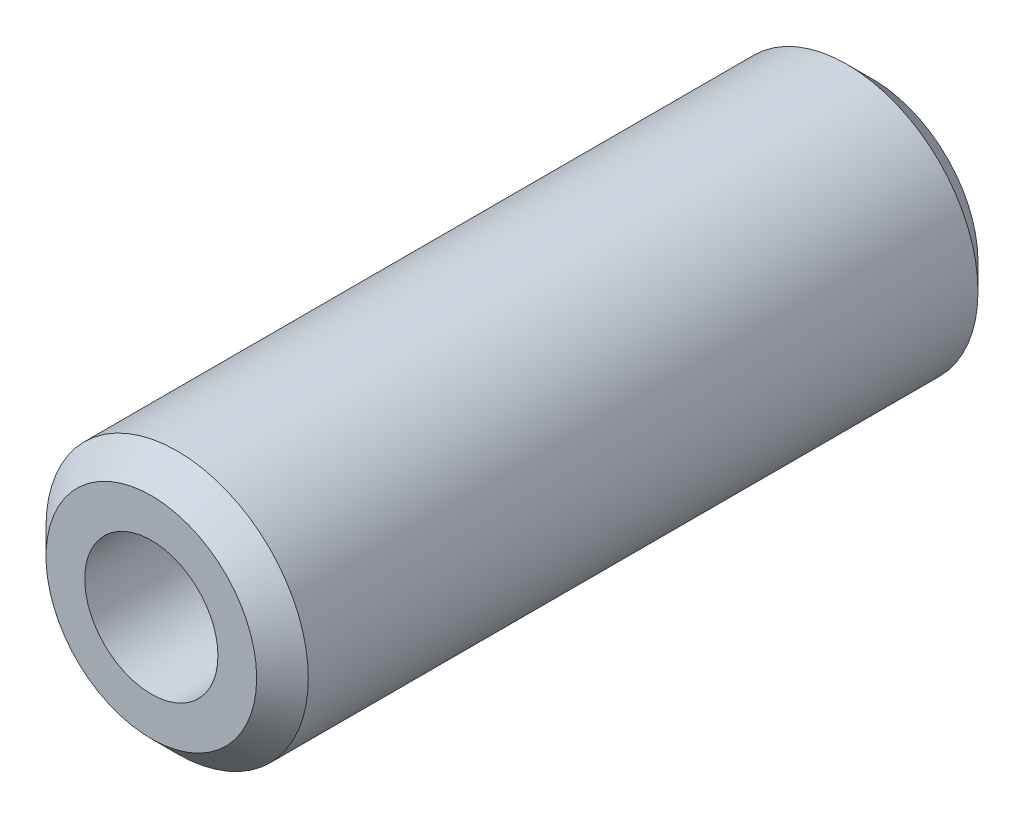
from build123d import *

# Parameters (mm, degrees)
SKETCH1_R               = 12.7
BOSS_EXTRUDE1_DEPTH     = 69.85
CUT_EXTRUDE1_DEPTH      = 73.122135992
CUT_EXTRUDE1_DEPTH_BACK = 73.122135992
SKETCH2_R               = 6.45
CHAMFER1_SIZE           = 2.5


with BuildPart() as part:
    # Sketch1 → Boss-Extrude1 (new body)
    with BuildSketch(Plane.XY):
        Circle(SKETCH1_R)
    extrude(amount=BOSS_EXTRUDE1_DEPTH)

    # Sketch2 → Cut-Extrude1 (cut, two sides: drawn at the far end of the back side and taken through both)
    with BuildSketch(Plane.XY.offset(69.85).offset(-CUT_EXTRUDE1_DEPTH_BACK)):
        Circle(SKETCH2_R)
    extrude(amount=CUT_EXTRUDE1_DEPTH + CUT_EXTRUDE1_DEPTH_BACK, mode=Mode.SUBTRACT)

    # Chamfer1
    chamfer1_edges = [part.edges().sort_by_distance(p)[0] for p in [
        (-12.7, 0, 69.85),
        (-12.7, 0, 0),
    ]]
    chamfer(chamfer1_edges, length=CHAMFER1_SIZE)


solid = part.part
